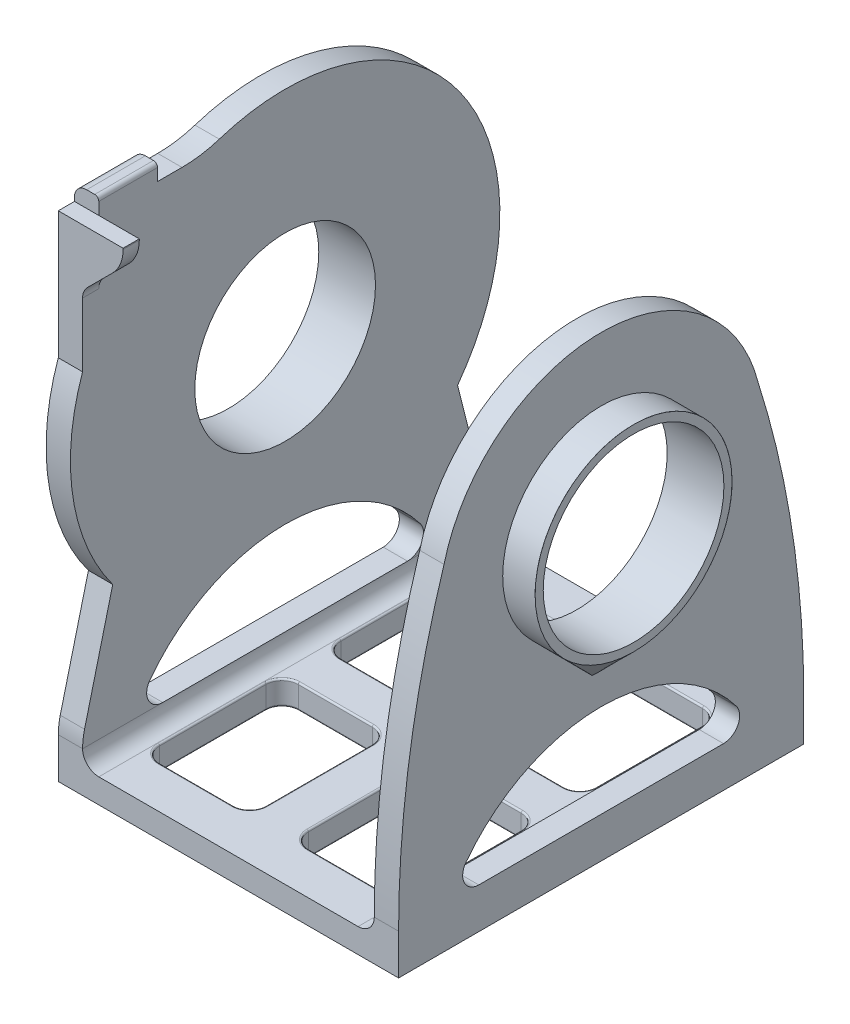
from build123d import *

# Parameters (mm, degrees)
BOSS_EXTRUDE1_DEPTH = 50
SKETCH2_R           = 11.15
CUT_EXTRUDE1_DEPTH  = 88.338422244
BOSS_EXTRUDE2_DEPTH = 2
SPLIT1_START        = -21
SPLIT1_OUTLINE_W    = 2
SPLIT1_OUTLINE_H    = 11.25
SPLIT1_DEPTH        = 21
SKETCH8_W           = 3
SKETCH8_H           = 7.25
BOSS_EXTRUDE3_DEPTH = 2
BOSS_EXTRUDE4_DEPTH = 2
FILLET3_R           = 2
FILLET5_R           = 4.5
BOSS_EXTRUDE5_DEPTH = 3
CUT_EXTRUDE8_DEPTH  = 90.157164603
FILLET6_R           = 1.5
FILLET8_R           = 15
FILLET11_R          = 0.5
CUT_EXTRUDE10_START = -38
CUT_EXTRUDE10_DEPTH = 10
BOSS_EXTRUDE6_START = -3
SKETCH13_R          = 13.95182136
BOSS_EXTRUDE6_DEPTH = 3
SKETCH14_W          = 13.125
SKETCH14_H          = 17.125
CUT_EXTRUDE11_DEPTH = 10
FILLET16_R          = 2
FILLET17_R          = 0.2
CUT_EXTRUDE12_DEPTH = 10
CUT_EXTRUDE13_START = 39
CUT_EXTRUDE13_DEPTH = 10
CUT_EXTRUDE14_DEPTH = 10
CUT_EXTRUDE16_START = -52
CUT_EXTRUDE16_DEPTH = 10


# Read off the part's stored shape, not the designer's step: Split1
with BuildPart() as part:
    # Sketch1 → Boss-Extrude1 (new body)
    with BuildSketch(Plane.XY):
        with BuildLine():
            Line((0, 0), (16, 0))
            ThreePointArc((16, 0), (17.414213562, 0.585786438), (18, 2))
            Line((18, 2), (18, 58))
            Line((18, 58), (21, 58))
            Line((21, 58), (21, 2))
            Line((21, 2), (21, -3))
            Line((21, -3), (-21, -3))
            Line((-21, -3), (-21, 2))
            Line((-21, 2), (-21, 58))
            Line((-21, 58), (-18, 58))
            Line((-18, 58), (-18, 2))
            ThreePointArc((-18, 2), (-17.414213562, 0.585786438), (-16, 0))
            Line((-16, 0), (0, 0))
        make_face()
    extrude(amount=BOSS_EXTRUDE1_DEPTH)

    # Sketch2 → Cut-Extrude1 (cut, through all)
    with BuildSketch(Plane(origin=(21, 0, 0), x_dir=(0, 0, -1), z_dir=(1, 0, 0))):
        with Locations((-25, 33.5)):
            Circle(SKETCH2_R)
    extrude(amount=-CUT_EXTRUDE1_DEPTH, mode=Mode.SUBTRACT)

    # Sketch3 → Revolve1 (revolve)
    with BuildSketch(Plane(origin=(0, 0, 25), x_dir=(-1, 0, 0), z_dir=(0, 0, -1)), mode=Mode.PRIVATE) as revolve1_sk:
        Polygon((-21, 44.65), (-25, 44.65), (-25, 45.65), (-21, 49.65), align=None)
    revolve(revolve1_sk.sketch.rotate(Axis((21, 33.5, 25), (1, 0, 0)), 270), axis=Axis((21, 33.5, 25), (1, 0, 0)))

    # Sketch4 → Revolve2 (revolve)
    with BuildSketch(Plane(origin=(0, 0, 25), x_dir=(-1, 0, 0), z_dir=(0, 0, -1)), mode=Mode.PRIVATE) as revolve2_sk:
        Polygon((21, 49.65), (25, 45.65), (25, 44.65), (21, 44.65), align=None)
    revolve(revolve2_sk.sketch.rotate(Axis((-21, 33.5, 25), (-1, 0, 0)), 90), axis=Axis((-21, 33.5, 25), (-1, 0, 0)))

    # Sketch8 → Boss-Extrude3 (add)
    with BuildSketch(Plane(origin=(0, 58, 0), x_dir=(1, 0, 0), z_dir=(0, 1, 0))):
        with Locations((-19.5, -44.375)):
            Rectangle(SKETCH8_W, SKETCH8_H)
    extrude(amount=BOSS_EXTRUDE3_DEPTH)

    # Sketch9 → Boss-Extrude4 (add)
    with BuildSketch(Plane.XY.offset(50)):
        Polygon((-18, 58), (-13, 58), (-13, 56), (-18, 51), align=None)
    extrude(amount=-BOSS_EXTRUDE4_DEPTH)

    # Fillet3
    fillet3_edges = [part.edges().sort_by_distance(p)[0] for p in [
        (-18, 51, 49),
    ]]
    fillet(fillet3_edges, radius=FILLET3_R)

    # Fillet5
    fillet5_edges = [part.edges().sort_by_distance(p)[0] for p in [
        (-13, 56, 49),
    ]]
    fillet(fillet5_edges, radius=FILLET5_R)

    # Sketch10 → Boss-Extrude5 (add)
    with BuildSketch(Plane(origin=(-18, 0, 0), x_dir=(0, 0, -1), z_dir=(1, 0, 0))):
        with BuildLine():
            Line((-35.099504938, 58), (-14.900495062, 58))
            ThreePointArc((-14.900495062, 58), (-25, 60), (-35.099504938, 58))
        make_face()
    extrude(amount=-BOSS_EXTRUDE5_DEPTH)

    # Sketch11 → Cut-Extrude8 (cut, through all)
    with BuildSketch(Plane(origin=(-18, 0, 0), x_dir=(0, 0, -1), z_dir=(1, 0, 0))):
        with BuildLine():
            Line((-14.900495062, 58), (0, 58))
            Line((0, 58), (0, 42.289197916))
            ThreePointArc((0, 42.289197916), (-5.772386075, 51.735922317), (-14.900495062, 58))
        make_face()
    extrude(amount=-CUT_EXTRUDE8_DEPTH, mode=Mode.SUBTRACT)

    # Fillet6
    fillet6_edges = [part.edges().sort_by_distance(p)[0] for p in [
        (-21, 60, 44.375),
    ]]
    fillet(fillet6_edges, radius=FILLET6_R)

    # Fillet8
    fillet8_edges = [part.edges().sort_by_distance(p)[0] for p in [
        (-19.5, 58, 35.099504938),
        (-19.5, 42.289197916, 0),
    ]]
    fillet(fillet8_edges, radius=FILLET8_R)

    # Fillet11
    fillet11_edges = [part.edges().sort_by_distance(p)[0] for p in [
        (-18, 60, 44.375),
    ]]
    fillet(fillet11_edges, radius=FILLET11_R)

    # Sketch12 → Cut-Extrude10 (cut)
    with BuildSketch(Plane(origin=(21, 0, 0), x_dir=(0, 0, -1), z_dir=(1, 0, 0)).offset(CUT_EXTRUDE10_START)):
        with BuildLine():
            Line((-3.722482216, 17.703885385), (-0.244360609, 3.965229699))
            ThreePointArc((-0.244360609, 3.965229699), (-0.061325497, 2.992357869), (0, 2.004319088))
            Line((0, 2.004319088), (0, 2.003072929))
            ThreePointArc((0, 2.003072929), (2.541010162, 13.356937507), (0, 24.710802084))
            ThreePointArc((0, 24.710802084), (-1.597513306, 21.067236167), (-3.722482216, 17.703885385))
        make_face()
        with BuildLine():
            Line((-50, 2.003072929), (-50, 2.004319088))
            ThreePointArc((-50, 2.004319088), (-49.938674503, 2.992357869), (-49.755639391, 3.965229699))
            Line((-49.755639391, 3.965229699), (-46.277517784, 17.703885385))
            ThreePointArc((-46.277517784, 17.703885385), (-48.402486694, 21.067236167), (-50, 24.710802084))
            ThreePointArc((-50, 24.710802084), (-52.0562682, 13.356937507), (-50, 2.003072929))
        make_face()
    extrude(amount=-CUT_EXTRUDE10_DEPTH, mode=Mode.SUBTRACT)

    # Sketch13 → Boss-Extrude6 (add)
    with BuildSketch(Plane.ZY.offset(21).offset(BOSS_EXTRUDE6_START)):
        with BuildLine():
            ThreePointArc((39.246039414, 11.154970105), (25, 60), (10.753960586, 11.154970105))
            ThreePointArc((10.753960586, 11.154970105), (25, 16.749910851), (39.246039414, 11.154970105))
        make_face()
        with Locations((25, 33.5)):
            Circle(SKETCH13_R, mode=Mode.SUBTRACT)
    extrude(amount=BOSS_EXTRUDE6_DEPTH)

    # Sketch14 → Cut-Extrude11 (cut)
    with BuildSketch(Plane.XZ.offset(3)):
        with Locations((-9.1875, 36.1875)):
            Rectangle(SKETCH14_W, SKETCH14_H)
        with Locations((9.1875, 36.1875)):
            Rectangle(SKETCH14_W, SKETCH14_H)
        with Locations((9.1875, 13.8125)):
            Rectangle(SKETCH14_W, SKETCH14_H)
        with Locations((-9.1875, 13.8125)):
            Rectangle(SKETCH14_W, SKETCH14_H)
    extrude(amount=-CUT_EXTRUDE11_DEPTH, mode=Mode.SUBTRACT)

    # Fillet16
    fillet16_edges = [part.edges().sort_by_distance(p)[0] for p in [
        (-2.625, -1.5, 22.375),
        (-2.625, -1.5, 5.25),
        (-15.75, -1.5, 5.25),
        (-15.75, -1.5, 22.375),
        (2.625, -1.5, 5.25),
        (2.625, -1.5, 22.375),
        (15.75, -1.5, 22.375),
        (15.75, -1.5, 5.25),
        (-15.75, -1.5, 44.75),
        (-2.625, -1.5, 44.75),
        (-2.625, -1.5, 27.625),
        (-15.75, -1.5, 27.625),
        (2.625, -1.5, 44.75),
        (15.75, -1.5, 44.75),
        (15.75, -1.5, 27.625),
        (2.625, -1.5, 27.625),
    ]]
    fillet(fillet16_edges, radius=FILLET16_R)

    # Fillet17
    fillet17_edges = [part.edges().sort_by_distance(p)[0] for p in [
        (15.75, -3, 36.1875),
        (15.75, 0, 36.1875),
        (9.1875, -3, 27.625),
        (9.1875, 0, 27.625),
        (9.1875, -3, 22.375),
        (9.1875, 0, 22.375),
        (15.75, -3, 13.8125),
        (15.75, 0, 13.8125),
        (9.1875, -3, 44.75),
        (9.1875, 0, 44.75),
        (-9.1875, -3, 44.75),
        (-9.1875, 0, 44.75),
        (-2.625, -3, 36.1875),
        (-2.625, 0, 36.1875),
        (2.625, -3, 36.1875),
        (2.625, 0, 36.1875),
        (2.625, -3, 13.8125),
        (2.625, 0, 13.8125),
        (-15.75, -3, 36.1875),
        (-15.75, 0, 36.1875),
        (-9.1875, -3, 27.625),
        (-9.1875, 0, 27.625),
        (9.1875, -3, 5.25),
        (9.1875, 0, 5.25),
        (-9.1875, -3, 22.375),
        (-9.1875, 0, 22.375),
        (-2.625, -3, 13.8125),
        (-2.625, 0, 13.8125),
        (-15.75, -3, 13.8125),
        (-15.75, 0, 13.8125),
        (-9.1875, -3, 5.25),
        (-9.1875, 0, 5.25),
        (15.164213562, -3, 28.210786438),
        (15.164213562, 0, 28.210786438),
        (15.164213562, -3, 21.789213562),
        (15.164213562, 0, 21.789213562),
        (15.164213562, -3, 44.164213562),
        (15.164213562, 0, 44.164213562),
        (-3.210786438, -3, 44.164213562),
        (-3.210786438, 0, 44.164213562),
        (3.210786438, -3, 44.164213562),
        (3.210786438, 0, 44.164213562),
        (3.210786438, -3, 21.789213562),
        (3.210786438, 0, 21.789213562),
        (-15.164213562, -3, 44.164213562),
        (-15.164213562, 0, 44.164213562),
        (-15.164213562, -3, 28.210786438),
        (-15.164213562, 0, 28.210786438),
        (3.210786438, -3, 28.210786438),
        (3.210786438, 0, 28.210786438),
        (3.210786438, -3, 5.835786438),
        (3.210786438, 0, 5.835786438),
        (15.164213562, -3, 5.835786438),
        (15.164213562, 0, 5.835786438),
        (-3.210786438, -3, 28.210786438),
        (-3.210786438, 0, 28.210786438),
        (-3.210786438, -3, 21.789213562),
        (-3.210786438, 0, 21.789213562),
        (-15.164213562, -3, 21.789213562),
        (-15.164213562, 0, 21.789213562),
        (-3.210786438, -3, 5.835786438),
        (-3.210786438, 0, 5.835786438),
        (-15.164213562, -3, 5.835786438),
        (-15.164213562, 0, 5.835786438),
    ]]
    fillet(fillet17_edges, radius=FILLET17_R)

    # Sketch5 → Cut-Extrude12 (cut)
    with BuildSketch(Plane.ZY.offset(-18)):
        with BuildLine():
            Line((9.908101803, 1.999973275), (40.091898197, 1.999973275))
            ThreePointArc((40.091898197, 1.999973275), (41.882928462, 3.109911149), (41.686026402, 5.207762687))
            ThreePointArc((41.686026402, 5.207762687), (34.355748958, 11.293063381), (25.087835818, 13.499789005))
            ThreePointArc((25.087835818, 13.499789005), (25, 13.499596129), (24.912164182, 13.499789005))
            ThreePointArc((24.912164182, 13.499789005), (15.644251042, 11.293063381), (8.313973598, 5.207762687))
            ThreePointArc((8.313973598, 5.207762687), (8.117071538, 3.109911149), (9.908101803, 1.999973275))
        make_face()
        with BuildLine():
            ThreePointArc((0, 2), (1.411025729, 20.420002059), (5.611666094, 38.410057367))
            ThreePointArc((5.611666094, 38.410057367), (25.00404306, 53.500403462), (44.390317447, 38.402218305))
            ThreePointArc((44.390317447, 38.402218305), (48.589357437, 20.415959031), (50, 2))
            Line((50, 2), (50, 58))
            Line((50, 58), (0, 58))
            Line((0, 58), (0, 2))
        make_face()
    extrude(amount=-CUT_EXTRUDE12_DEPTH, mode=Mode.SUBTRACT)

    # Sketch5<7> → Cut-Extrude13 (cut)
    with BuildSketch(Plane.ZY.offset(-18).offset(CUT_EXTRUDE13_START)):
        with BuildLine():
            Line((9.908101803, 1.999973275), (40.091898197, 1.999973275))
            ThreePointArc((40.091898197, 1.999973275), (41.882928462, 3.109911149), (41.686026402, 5.207762687))
            ThreePointArc((41.686026402, 5.207762687), (34.355748958, 11.293063381), (25.087835818, 13.499789005))
            ThreePointArc((25.087835818, 13.499789005), (25, 13.499596129), (24.912164182, 13.499789005))
            ThreePointArc((24.912164182, 13.499789005), (15.644251042, 11.293063381), (8.313973598, 5.207762687))
            ThreePointArc((8.313973598, 5.207762687), (8.117071538, 3.109911149), (9.908101803, 1.999973275))
        make_face()
    extrude(amount=-CUT_EXTRUDE13_DEPTH, mode=Mode.SUBTRACT)

    # Sketch6 → Cut-Extrude14 (cut)
    with BuildSketch(Plane(origin=(21, 0, 0), x_dir=(0, 0, -1), z_dir=(1, 0, 0))):
        with BuildLine():
            Line((-24.03003345, 17.240081449), (-16.382474881, 24.934007611))
            ThreePointArc((-16.382474881, 24.934007611), (-25.00035973, 45.650434712), (-33.617701527, 24.933781714))
            Line((-33.617701527, 24.933781714), (-25.96996655, 17.240081449))
            Line((-25.96996655, 17.240081449), (-26.400304229, 15.077606676))
            Line((-26.400304229, 15.077606676), (-37.149684585, 14.752719948))
            Line((-37.149684585, 14.752719948), (-37.149684585, 16.897350741))
            ThreePointArc((-37.149684585, 16.897350741), (-25.00025434, 54.072868813), (-12.850629427, 16.897414362))
            Line((-12.850629427, 16.897414362), (-12.850963038, 14.753030686))
            Line((-12.850963038, 14.753030686), (-23.542945523, 15.077317695))
            Line((-23.542945523, 15.077317695), (-24.03003345, 17.240081449))
        make_face()
    extrude(amount=CUT_EXTRUDE14_DEPTH, mode=Mode.SUBTRACT)

    # Sketch6<9> → Cut-Extrude16 (cut)
    with BuildSketch(Plane(origin=(21, 0, 0), x_dir=(0, 0, -1), z_dir=(1, 0, 0)).offset(CUT_EXTRUDE16_START)):
        with BuildLine():
            Line((-24.03003345, 17.240081449), (-16.382474881, 24.934007611))
            ThreePointArc((-16.382474881, 24.934007611), (-25.00035973, 45.650434712), (-33.617701527, 24.933781714))
            Line((-33.617701527, 24.933781714), (-25.96996655, 17.240081449))
            Line((-25.96996655, 17.240081449), (-26.400304229, 15.077606676))
            Line((-26.400304229, 15.077606676), (-37.149684585, 14.752719948))
            Line((-37.149684585, 14.752719948), (-37.149684585, 16.897350741))
            ThreePointArc((-37.149684585, 16.897350741), (-25.00025434, 54.072868813), (-12.850629427, 16.897414362))
            Line((-12.850629427, 16.897414362), (-12.850963038, 14.753030686))
            Line((-12.850963038, 14.753030686), (-23.542945523, 15.077317695))
            Line((-23.542945523, 15.077317695), (-24.03003345, 17.240081449))
        make_face()
    extrude(amount=CUT_EXTRUDE16_DEPTH, mode=Mode.SUBTRACT)


with BuildPart() as body_2:
    # Sketch7 → Boss-Extrude2 (new body)
    with BuildSketch(Plane(origin=(0, 58, 0), x_dir=(1, 0, 0), z_dir=(0, 1, 0))):
        Polygon((-21, -50), (-21, -48), (-2, -48), (-2, -40.75), (-15, -40.75), (-21, -40.75), (-21, -38.75), (0, -38.75), (0, -40.75), (0, -50), (-2, -50), align=None)
    extrude(amount=BOSS_EXTRUDE2_DEPTH)

    # Split1 outline → Split1 (cut)
    with BuildSketch(Plane.YZ.offset(SPLIT1_START)):
        with Locations((59, 44.375)):
            Rectangle(SPLIT1_OUTLINE_W, SPLIT1_OUTLINE_H)
    extrude(amount=SPLIT1_DEPTH, mode=Mode.SUBTRACT)


solid = part.part
